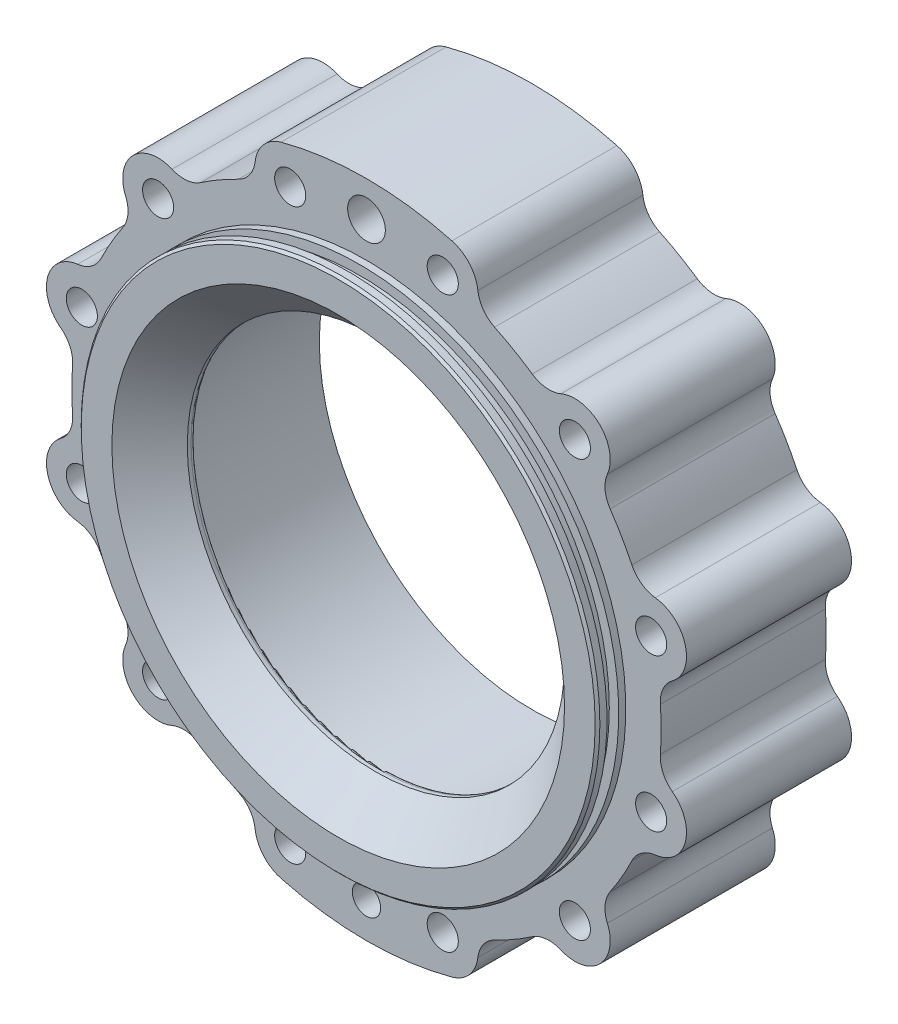
from build123d import *

# Parameters (mm, degrees)
SKETCH2_R            = 3
CUT_EXTRUDE1_DEPTH   = 9
SKETCH3_R            = 4
CUT_EXTRUDE2_DEPTH   = 10
SKETCH9_W            = 2
SKETCH9_H            = 2.5
CHAMFER1_SIZE        = 0.5
M6_CLEARANCE_HOLE1_D = 6.6
FILLET2_R            = 1
CHAMFER2_SIZE        = 8
CUT_EXTRUDE3_DEPTH   = 108.14942837


with BuildPart() as part:
    # Sketch1 → Revolve1 (revolve)
    with BuildSketch(Plane(origin=(0, 0, 0), x_dir=(1, 0, 0), z_dir=(0, 1, 0))):
        Polygon((-55, -15.79575879), (-55, -9.79575879), (-70, -9.79575879), (-70, 25.20424121), (-45, 25.20424121), (-45, -6), (-40, -6), (-40, -15.79575879), align=None)
    revolve(axis=Axis((0, 0, -52.707374268), (0, 0, 1)))

    # Sketch2 → Cut-Extrude1 (cut)
    with BuildSketch(Plane.XY.offset(9.79575879)):
        with Locations((0, -62.5)):
            Circle(SKETCH2_R)
    extrude(amount=-CUT_EXTRUDE1_DEPTH, mode=Mode.SUBTRACT)

    # Sketch3 → Cut-Extrude2 (cut)
    with BuildSketch(Plane.XY.offset(9.79575879)):
        with Locations((0, 62.5)):
            Circle(SKETCH3_R)
    extrude(amount=-CUT_EXTRUDE2_DEPTH, mode=Mode.SUBTRACT)

    # Sketch9 → Oring groove (revolve, cut)
    with BuildSketch(Plane(origin=(0, 0, 0), x_dir=(1, 0, 0), z_dir=(0, 1, 0))):
        with Locations((-54, -12.54575879)):
            Rectangle(SKETCH9_W, SKETCH9_H)
    revolve(axis=Axis((0, 0, -11.30771881), (0, 0, 1)), mode=Mode.SUBTRACT)

    # Chamfer1
    chamfer1_edges = [part.edges().sort_by_distance(p)[0] for p in [
        (55, 0, 15.79575879),
    ]]
    chamfer(chamfer1_edges, length=CHAMFER1_SIZE)

    # M6 Clearance Hole1 (through all)
    with Locations(Plane.XY.offset(9.79575879)):
        with Locations((-60.370364143, 16.176190319), (-44.194173824, 44.194173824), (-16.176190319, 60.370364143), (16.176190319, 60.370364143), (44.194173824, 44.194173824), (60.370364143, 16.176190319), (60.370364143, -16.176190319), (44.194173824, -44.194173824), (16.176190319, -60.370364143), (-16.176190319, -60.370364143), (-44.194173824, -44.194173824), (-60.370364143, -16.176190319), (0, 0)):
            Hole(M6_CLEARANCE_HOLE1_D / 2)

    # Fillet2
    fillet2_edges = [part.edges().sort_by_distance(p)[0] for p in [
        (40, 0, 6),
    ]]
    fillet(fillet2_edges, radius=FILLET2_R)

    # Chamfer2
    chamfer2_edges = [part.edges().sort_by_distance(p)[0] for p in [
        (40, 0, 15.79575879),
    ]]
    chamfer(chamfer2_edges, length=CHAMFER2_SIZE)

    # Sketch11 → Cut-Extrude3 (cut, through all)
    with BuildSketch(Plane(origin=(0, 0, -25.20424121), x_dir=(-1, 0, 0), z_dir=(0, 0, -1))):
        with BuildLine():
            ThreePointArc((-67.614807815, -18.11733325), (-67.456961364, -13.720556017), (-64.860498316, -10.168803607))
            ThreePointArc((-64.860498316, -10.168803607), (-62.883679675, -7.71538746), (-62.329470997, -4.613788603))
            ThreePointArc((-62.329470997, -4.613788603), (-62.5, 0), (-62.329470997, 4.613788603))
            ThreePointArc((-62.329470997, 4.613788603), (-62.883679675, 7.71538746), (-64.860498316, 10.168803607))
            ThreePointArc((-64.860498316, 10.168803607), (-67.456961364, 13.720556017), (-67.614807815, 18.11733325))
            ThreePointArc((-67.614807815, 18.11733325), (-70, 0), (-67.614807815, -18.11733325))
        make_face()
        with BuildLine():
            ThreePointArc((-61.255241048, -23.623806908), (-65.279720139, -21.84613068), (-67.614807815, -18.11733325))
            ThreePointArc((-67.614807815, -18.11733325), (-60.62177824, -35.000000043), (-49.497474681, -49.497474685))
            ThreePointArc((-49.497474681, -49.497474685), (-51.559164204, -45.610830701), (-51.086437441, -41.236691408))
            ThreePointArc((-51.086437441, -41.236691408), (-50.601170352, -38.123561378), (-51.672010986, -35.160393636))
            ThreePointArc((-51.672010986, -35.160393636), (-54.126587737, -31.25), (-56.285799589, -27.169077361))
            ThreePointArc((-56.285799589, -27.169077361), (-58.316557812, -24.760118297), (-61.255241048, -23.623806908))
        make_face()
        with BuildLine():
            ThreePointArc((-49.497474674, 49.497474692), (-60.621778238, 35.000000047), (-67.614807815, 18.11733325))
            ThreePointArc((-67.614807815, 18.11733325), (-65.279720139, 21.84613068), (-61.255241048, 23.623806908))
            ThreePointArc((-61.255241048, 23.623806908), (-58.316557812, 24.760118297), (-56.285799589, 27.169077361))
            ThreePointArc((-56.285799589, 27.169077361), (-54.126587737, 31.25), (-51.672010986, 35.160393636))
            ThreePointArc((-51.672010986, 35.160393636), (-50.601170352, 38.123561378), (-51.086437441, 41.236691408))
            ThreePointArc((-51.086437441, 41.236691408), (-51.559164203, 45.610830706), (-49.497474674, 49.497474692))
        make_face()
        with BuildLine():
            ThreePointArc((-41.236691408, -51.086437441), (-45.610830698, -51.559164204), (-49.497474681, -49.497474685))
            ThreePointArc((-49.497474681, -49.497474685), (-34.999999999, -60.621778266), (-18.117333157, -67.61480784))
            ThreePointArc((-18.117333157, -67.61480784), (-21.846130649, -65.279720176), (-23.623806908, -61.255241048))
            ThreePointArc((-23.623806908, -61.255241048), (-24.760118297, -58.316557812), (-27.169077361, -56.285799589))
            ThreePointArc((-27.169077361, -56.285799589), (-31.25, -54.126587737), (-35.160393636, -51.672010986))
            ThreePointArc((-35.160393636, -51.672010986), (-38.123561378, -50.601170352), (-41.236691408, -51.086437441))
        make_face()
        with BuildLine():
            ThreePointArc((-18.117333157, 67.61480784), (-34.999999995, 60.621778268), (-49.497474674, 49.497474692))
            ThreePointArc((-49.497474674, 49.497474692), (-45.610830694, 51.559164205), (-41.236691408, 51.086437441))
            ThreePointArc((-41.236691408, 51.086437441), (-38.123561378, 50.601170352), (-35.160393636, 51.672010986))
            ThreePointArc((-35.160393636, 51.672010986), (-31.25, 54.126587737), (-27.169077361, 56.285799589))
            ThreePointArc((-27.169077361, 56.285799589), (-24.760118297, 58.316557812), (-23.623806908, 61.255241048))
            ThreePointArc((-23.623806908, 61.255241048), (-21.846130649, 65.279720176), (-18.117333157, 67.61480784))
        make_face()
        with BuildLine():
            ThreePointArc((23.623806908, -61.255241048), (21.846130649, -65.279720176), (18.117333157, -67.61480784))
            ThreePointArc((18.117333157, -67.61480784), (34.999999979, -60.621778277), (49.49747465, -49.497474717))
            ThreePointArc((49.49747465, -49.497474717), (45.610830676, -51.559164209), (41.236691408, -51.086437441))
            ThreePointArc((41.236691408, -51.086437441), (38.123561378, -50.601170352), (35.160393636, -51.672010986))
            ThreePointArc((35.160393636, -51.672010986), (31.25, -54.126587737), (27.169077361, -56.285799589))
            ThreePointArc((27.169077361, -56.285799589), (24.760118297, -58.316557812), (23.623806908, -61.255241048))
        make_face()
        with BuildLine():
            ThreePointArc((49.497474683, 49.497474683), (35, 60.621778265), (18.117333157, 67.61480784))
            ThreePointArc((18.117333157, 67.61480784), (21.846130649, 65.279720176), (23.623806908, 61.255241048))
            ThreePointArc((23.623806908, 61.255241048), (24.760118297, 58.316557812), (27.169077361, 56.285799589))
            ThreePointArc((27.169077361, 56.285799589), (31.25, 54.126587737), (35.160393636, 51.672010986))
            ThreePointArc((35.160393636, 51.672010986), (38.123561378, 50.601170352), (41.236691408, 51.086437441))
            ThreePointArc((41.236691408, 51.086437441), (45.6108307, 51.559164204), (49.497474683, 49.497474683))
        make_face()
        with BuildLine():
            ThreePointArc((51.086437441, -41.236691408), (51.5591642, -45.610830723), (49.49747465, -49.497474717))
            ThreePointArc((49.49747465, -49.497474717), (60.621778241, -35.000000041), (67.614807828, -18.117333203))
            ThreePointArc((67.614807828, -18.117333203), (65.279720158, -21.846130664), (61.255241048, -23.623806908))
            ThreePointArc((61.255241048, -23.623806908), (58.316557812, -24.760118297), (56.285799589, -27.169077361))
            ThreePointArc((56.285799589, -27.169077361), (54.126587737, -31.25), (51.672010986, -35.160393636))
            ThreePointArc((51.672010986, -35.160393636), (50.601170352, -38.123561378), (51.086437441, -41.236691408))
        make_face()
        with BuildLine():
            ThreePointArc((67.614807952, 18.117332741), (60.621778373, 34.999999813), (49.497474683, 49.497474683))
            ThreePointArc((49.497474683, 49.497474683), (51.559164204, 45.6108307), (51.086437441, 41.236691408))
            ThreePointArc((51.086437441, 41.236691408), (50.601170352, 38.123561378), (51.672010986, 35.160393636))
            ThreePointArc((51.672010986, 35.160393636), (54.126587737, 31.25), (56.285799589, 27.169077361))
            ThreePointArc((56.285799589, 27.169077361), (58.316557812, 24.760118297), (61.255241048, 23.623806908))
            ThreePointArc((61.255241048, 23.623806908), (65.279720339, 21.846130508), (67.614807952, 18.117332741))
        make_face()
        with BuildLine():
            ThreePointArc((64.860498316, -10.168803607), (67.456961356, -13.720555994), (67.614807828, -18.117333203))
            ThreePointArc((67.614807828, -18.117333203), (70, -2.39e-07), (67.614807952, 18.117332741))
            ThreePointArc((67.614807952, 18.117332741), (67.456961278, 13.720555768), (64.860498316, 10.168803607))
            ThreePointArc((64.860498316, 10.168803607), (62.883679675, 7.71538746), (62.329470997, 4.613788603))
            ThreePointArc((62.329470997, 4.613788603), (62.5, 0), (62.329470997, -4.613788603))
            ThreePointArc((62.329470997, -4.613788603), (62.883679675, -7.71538746), (64.860498316, -10.168803607))
        make_face()
    extrude(amount=-CUT_EXTRUDE3_DEPTH, mode=Mode.SUBTRACT)


solid = part.part
